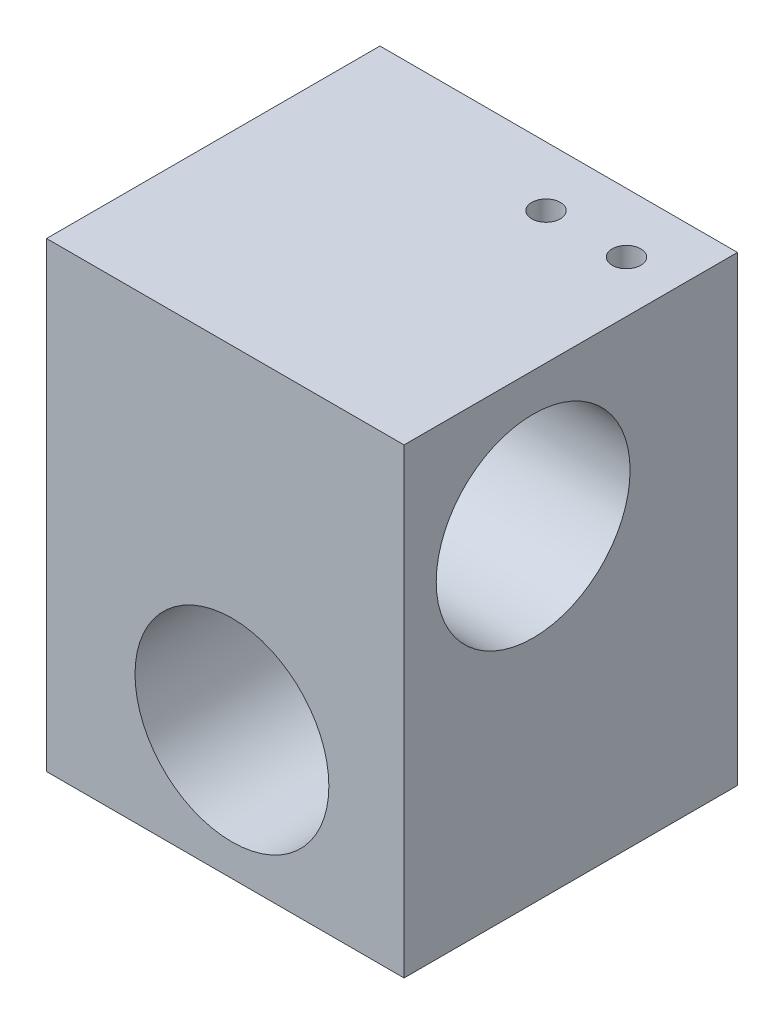
from build123d import *

# Parameters (mm, degrees)
SKETCH1_W                 = 25.4
SKETCH1_H                 = 25.4
BOSS_EXTRUDE1_DEPTH       = 28.7
SKETCH2_R                 = 6.0254
CUT_EXTRUDE1_DEPTH        = 41.969781598
SKETCH3_R                 = 6.025
CUT_EXTRUDE2_DEPTH        = 43.04456911
F_2_56_TAPPED_HOLE1_D     = 1.778
F_2_56_TAPPED_HOLE1_DEPTH = 6.6548
F_2_56_TAPPED_HOLE1_TIP   = 0.53416509
CUT_EXTRUDE3_DEPTH        = 37.500120491
F_2_56_TAPPED_HOLE2_D     = 1.778
F_2_56_TAPPED_HOLE2_DEPTH = 6.6548
F_2_56_TAPPED_HOLE2_TIP   = 0.53416509


with BuildPart() as part:
    # Sketch1 → Boss-Extrude1 (new body)
    with BuildSketch(Plane(origin=(0, 0, 0), x_dir=(1, 0, 0), z_dir=(0, 1, 0))):
        with Locations((1.780089924, 4.588602941)):
            Rectangle(SKETCH1_W, SKETCH1_H)
    extrude(amount=BOSS_EXTRUDE1_DEPTH)

    # Sketch2 → Cut-Extrude1 (cut, through all)
    with BuildSketch(Plane.XY.offset(8.111397059)):
        with Locations((3.780089924, 8)):
            Circle(SKETCH2_R)
    extrude(amount=-CUT_EXTRUDE1_DEPTH, mode=Mode.SUBTRACT)

    # Sketch3 → Cut-Extrude2 (cut, through all)
    with BuildSketch(Plane(origin=(14.480089924, 0, 0), x_dir=(0, 0, -1), z_dir=(1, 0, 0))):
        with Locations((4.588602941, 20.319)):
            Circle(SKETCH3_R)
    extrude(amount=-CUT_EXTRUDE2_DEPTH, mode=Mode.SUBTRACT)

    # #2-56 Tapped Hole1
    with Locations(Plane(origin=(0, 28.7, 0), x_dir=(1, 0, 0), z_dir=(0, 1, 0))):
        with Locations((6.280089924, 13.588602941), (11.280089924, 13.588602941)):
            Hole(F_2_56_TAPPED_HOLE1_D / 2, depth=F_2_56_TAPPED_HOLE1_DEPTH)
            with Locations((0, 0, -(F_2_56_TAPPED_HOLE1_DEPTH + F_2_56_TAPPED_HOLE1_TIP / 2))):  # 118° drill point
                Cone(0, F_2_56_TAPPED_HOLE1_D / 2, F_2_56_TAPPED_HOLE1_TIP, mode=Mode.SUBTRACT)

    # Sketch10 → Cut-Extrude3 (cut, through all)
    with BuildSketch(Plane(origin=(0, 28.7, 0), x_dir=(1, 0, 0), z_dir=(0, 1, 0))):
        Polygon((-7.744910076, -3.436397059), (14.480089924, -3.436397059), (14.480089924, -8.111397059), (-10.919910076, -8.111397059), (-10.919910076, 17.288602941), (-7.744910076, 17.288602941), align=None)
    extrude(amount=-CUT_EXTRUDE3_DEPTH, mode=Mode.SUBTRACT)

    # #2-56 Tapped Hole2
    with Locations(Plane(origin=(0, 0, 0), x_dir=(-1, 0, 0), z_dir=(0, -1, 0))):
        with Locations((3.934910076, 13.588602941), (3.934910076, 3.588602941)):
            Hole(F_2_56_TAPPED_HOLE2_D / 2, depth=F_2_56_TAPPED_HOLE2_DEPTH)
            with Locations((0, 0, -(F_2_56_TAPPED_HOLE2_DEPTH + F_2_56_TAPPED_HOLE2_TIP / 2))):  # 118° drill point
                Cone(0, F_2_56_TAPPED_HOLE2_D / 2, F_2_56_TAPPED_HOLE2_TIP, mode=Mode.SUBTRACT)


solid = part.part
